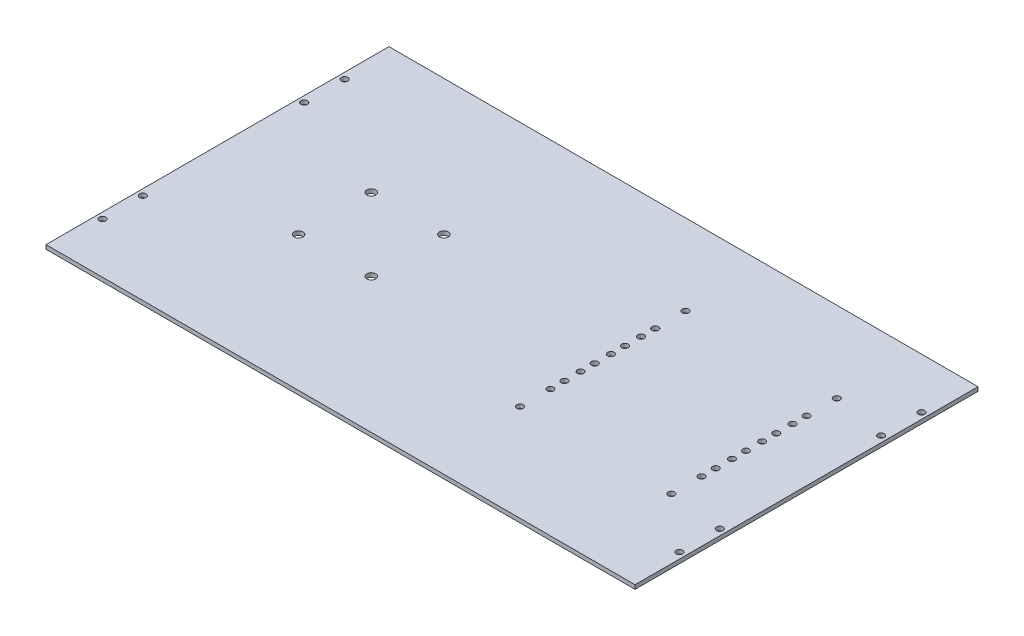
from build123d import *

# Parameters (mm, degrees)
SKETCH_1_W      = 292
SKETCH_1_H      = 170
SKETCH_1_R      = 1.6
SKETCH_1_R_2    = 2.2
EXTRUDE_1_DEPTH = 2


with BuildPart() as part:
    # 草图1 → 凸台-拉伸1 (new body)
    with BuildSketch(Plane(origin=(0, 0, 0), x_dir=(1, 0, 0), z_dir=(0, 1, 0))):
        with Locations((146, 85)):
            Rectangle(SKETCH_1_W, SKETCH_1_H)
        with Locations((3, 145)):
            Circle(SKETCH_1_R, mode=Mode.SUBTRACT)
        with Locations((3, 125)):
            Circle(SKETCH_1_R, mode=Mode.SUBTRACT)
        with Locations((3, 45)):
            Circle(SKETCH_1_R, mode=Mode.SUBTRACT)
        with Locations((3, 25)):
            Circle(SKETCH_1_R, mode=Mode.SUBTRACT)
        with Locations((289, 25)):
            Circle(SKETCH_1_R, mode=Mode.SUBTRACT)
        with Locations((289, 45)):
            Circle(SKETCH_1_R, mode=Mode.SUBTRACT)
        with Locations((289, 125)):
            Circle(SKETCH_1_R, mode=Mode.SUBTRACT)
        with Locations((289, 145)):
            Circle(SKETCH_1_R, mode=Mode.SUBTRACT)
        with Locations((187, 130)):
            Circle(SKETCH_1_R, mode=Mode.SUBTRACT)
        with Locations((262, 130)):
            Circle(SKETCH_1_R, mode=Mode.SUBTRACT)
        with Locations((262, 108)):
            Circle(SKETCH_1_R, mode=Mode.SUBTRACT)
        with Locations((187, 108)):
            Circle(SKETCH_1_R, mode=Mode.SUBTRACT)
        with Locations((187, 115)):
            Circle(SKETCH_1_R, mode=Mode.SUBTRACT)
        with Locations((262, 115)):
            Circle(SKETCH_1_R, mode=Mode.SUBTRACT)
        with Locations((187, 93)):
            Circle(SKETCH_1_R, mode=Mode.SUBTRACT)
        with Locations((262, 93)):
            Circle(SKETCH_1_R, mode=Mode.SUBTRACT)
        with Locations((187, 100)):
            Circle(SKETCH_1_R, mode=Mode.SUBTRACT)
        with Locations((262, 100)):
            Circle(SKETCH_1_R, mode=Mode.SUBTRACT)
        with Locations((187, 78)):
            Circle(SKETCH_1_R, mode=Mode.SUBTRACT)
        with Locations((262, 78)):
            Circle(SKETCH_1_R, mode=Mode.SUBTRACT)
        with Locations((187, 85)):
            Circle(SKETCH_1_R, mode=Mode.SUBTRACT)
        with Locations((262, 85)):
            Circle(SKETCH_1_R, mode=Mode.SUBTRACT)
        with Locations((187, 63)):
            Circle(SKETCH_1_R, mode=Mode.SUBTRACT)
        with Locations((262, 63)):
            Circle(SKETCH_1_R, mode=Mode.SUBTRACT)
        with Locations((187, 70)):
            Circle(SKETCH_1_R, mode=Mode.SUBTRACT)
        with Locations((262, 70)):
            Circle(SKETCH_1_R, mode=Mode.SUBTRACT)
        with Locations((187, 48)):
            Circle(SKETCH_1_R, mode=Mode.SUBTRACT)
        with Locations((262, 48)):
            Circle(SKETCH_1_R, mode=Mode.SUBTRACT)
        with Locations((58.224948847, 103)):
            Circle(SKETCH_1_R_2, mode=Mode.SUBTRACT)
        with Locations((94.224948847, 103)):
            Circle(SKETCH_1_R_2, mode=Mode.SUBTRACT)
        with Locations((94.224948847, 67)):
            Circle(SKETCH_1_R_2, mode=Mode.SUBTRACT)
        with Locations((58.224948847, 67)):
            Circle(SKETCH_1_R_2, mode=Mode.SUBTRACT)
    extrude(amount=EXTRUDE_1_DEPTH)


solid = part.part
